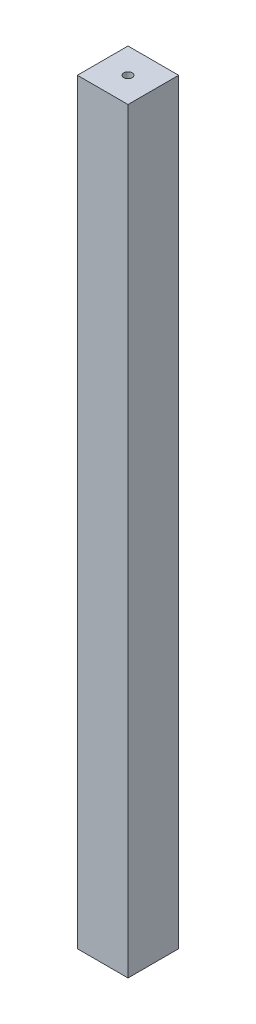
from build123d import *

# Parameters (mm, degrees)
SKETCH1_W           = 15
SKETCH1_H           = 15
BOSS_EXTRUDE1_DEPTH = 224
SKETCH2_R           = 1.25
CUT_EXTRUDE1_DEPTH  = 226.002222211


with BuildPart() as part:
    # Sketch1 → Boss-Extrude1 (new body)
    with BuildSketch(Plane(origin=(0, 0, 0), x_dir=(1, 0, 0), z_dir=(0, 1, 0))):
        with Locations((7.5, 7.5)):
            Rectangle(SKETCH1_W, SKETCH1_H)
    extrude(amount=BOSS_EXTRUDE1_DEPTH)

    # Sketch2 → Cut-Extrude1 (cut, through all)
    with BuildSketch(Plane(origin=(0, 224, 0), x_dir=(1, 0, 0), z_dir=(0, 1, 0))):
        with Locations((7.5, 7.5)):
            Circle(SKETCH2_R)
    extrude(amount=-CUT_EXTRUDE1_DEPTH, mode=Mode.SUBTRACT)


solid = part.part
